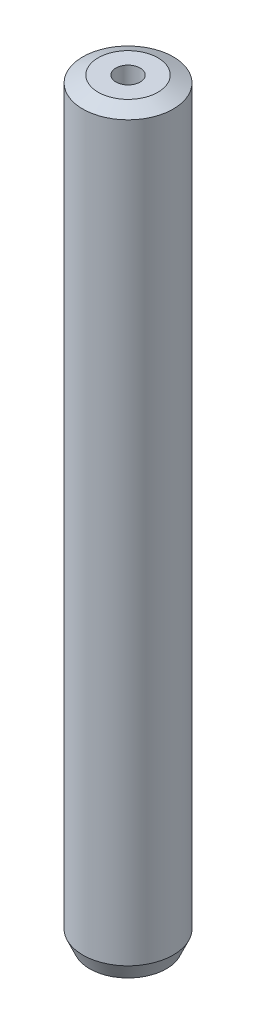
from build123d import *
from OCP.BRepFilletAPI import BRepFilletAPI_MakeChamfer

# Parameters (mm, degrees)
SKETCH1_R           = 10
BOSS_EXTRUDE1_DEPTH = 166.820570597
SKETCH2_R           = 2.68626259
CUT_EXTRUDE1_DEPTH  = 168.418943893
CHAMFER1_SIZE       = 1.509096882
CHAMFER1_SIZE2      = 3.39900241


with BuildPart() as part:
    # Sketch1 → Boss-Extrude1 (new body)
    with BuildSketch(Plane(origin=(0, 0, 0), x_dir=(1, 0, 0), z_dir=(0, 1, 0))):
        Circle(SKETCH1_R)
    extrude(amount=BOSS_EXTRUDE1_DEPTH)

    # Sketch2 → Cut-Extrude1 (cut, through all)
    with BuildSketch(Plane(origin=(0, 0, 0), x_dir=(1, 0, 0), z_dir=(0, 1, 0))):
        Circle(SKETCH2_R)
    extrude(amount=CUT_EXTRUDE1_DEPTH, mode=Mode.SUBTRACT)

    # Chamfer1: one chamfer whose edges measure the first distance from different faces: ONE call of the kernel's chamfer builder (chamfer() names one face for all edges)
    chamfer1_edges_1 = [part.edges().sort_by_distance(p)[0] for p in [
        (-10, 166.820570597, 0),
    ]]
    chamfer1_side_1 = [part.faces().sort_by_distance(p)[0] for p in [
        (-10, 83.410285299, 0),
    ]]
    chamfer1_edges_2 = [part.edges().sort_by_distance(p)[0] for p in [
        (-10, 0, 0),
    ]]
    chamfer1_side_2 = [part.faces().sort_by_distance(p)[0] for p in [
        (-9.717157288, 0, 0),
    ]]
    chamfer1 = BRepFilletAPI_MakeChamfer(part.part.solid().wrapped)
    for e in chamfer1_edges_1:
        chamfer1.Add(CHAMFER1_SIZE, CHAMFER1_SIZE2, e.wrapped, chamfer1_side_1[0].wrapped)  # the first distance lies on this face
    for e in chamfer1_edges_2:
        chamfer1.Add(CHAMFER1_SIZE, CHAMFER1_SIZE2, e.wrapped, chamfer1_side_2[0].wrapped)  # the first distance lies on this face
    add(Compound.cast(chamfer1.Shape()), mode=Mode.REPLACE)


solid = part.part
